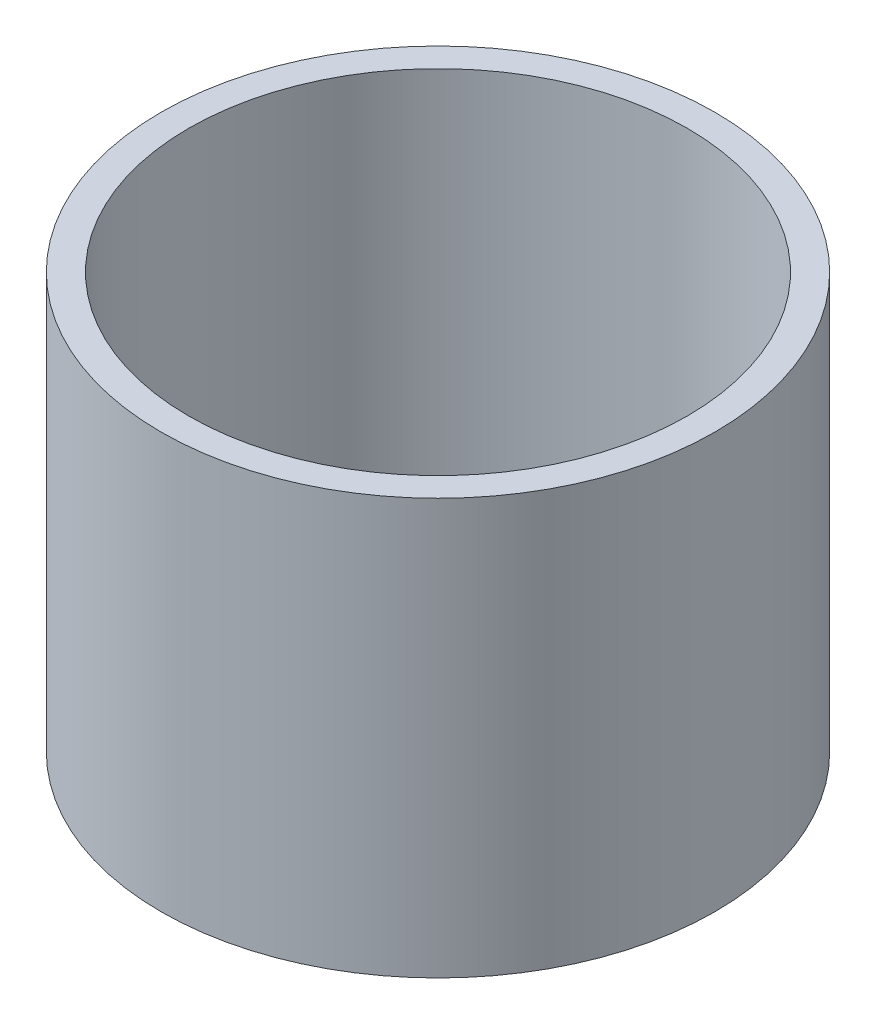
from build123d import *

# Parameters (mm, degrees)
ESBO_O2_R                = 100
ESBO_O2_R_2              = 90
RESSALTO_EXTRUS_O2_DEPTH = 150


with BuildPart() as part:
    # Esboço2 → Ressalto-extrusão2 (new body)
    with BuildSketch(Plane(origin=(0, 0, 0), x_dir=(1, 0, 0), z_dir=(0, 1, 0))):
        Circle(ESBO_O2_R)
        Circle(ESBO_O2_R_2, mode=Mode.SUBTRACT)
    extrude(amount=RESSALTO_EXTRUS_O2_DEPTH)


solid = part.part
